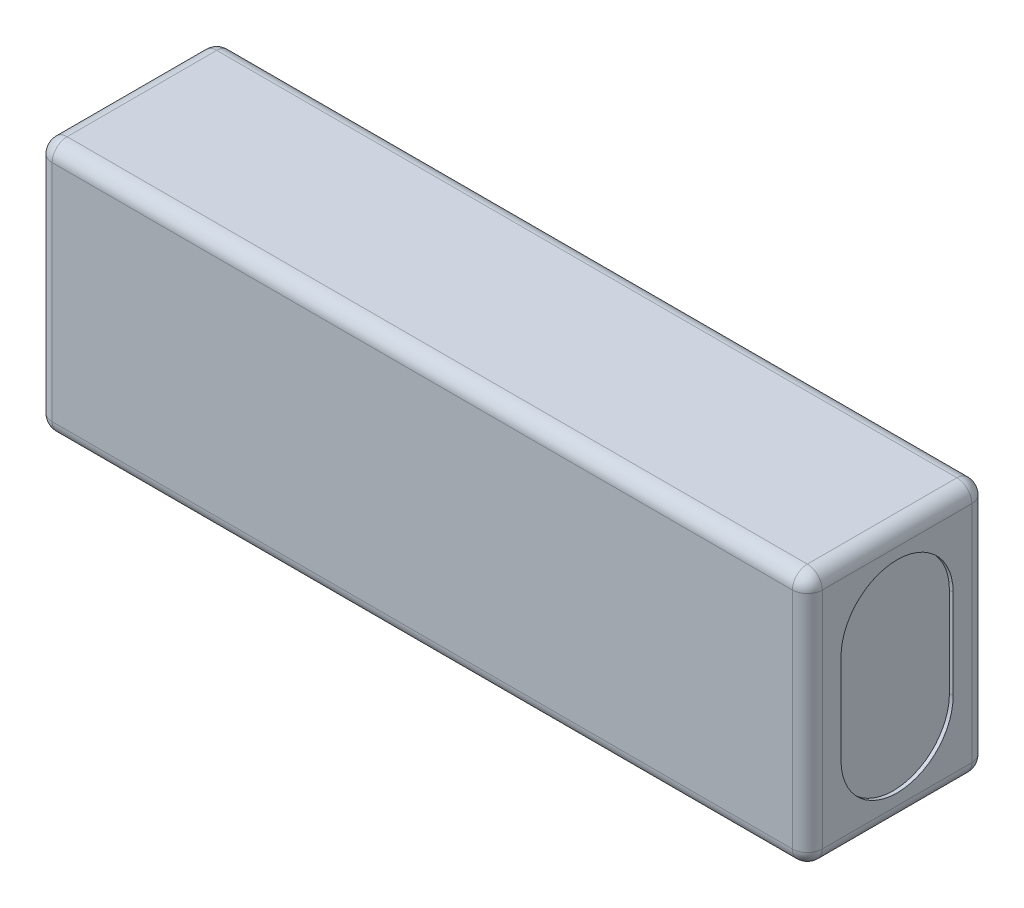
from build123d import *

# Parameters (mm, degrees)
ESBO_O1_W                = 103
ESBO_O1_H                = 34
RESSALTO_EXTRUS_O1_DEPTH = 24
CORTE_EXTRUS_O1_DEPTH    = 0.5
FILETE1_R                = 2
CORTAR_EXTRUIR1_DEPTH    = 3
CORTAR_EXTRUIR2_DEPTH    = 3


with BuildPart() as part:
    # Esboço1 → Ressalto-extrusão1 (new body)
    with BuildSketch(Plane.XY):
        Rectangle(ESBO_O1_W, ESBO_O1_H)
    extrude(amount=RESSALTO_EXTRUS_O1_DEPTH)

    # Esboço2 → Corte-extrusão1 (cut)
    with BuildSketch(Plane(origin=(51.5, 0, 0), x_dir=(0, 0, -1), z_dir=(1, 0, 0))):
        with BuildLine():
            Line((-4.5, 6), (-4.5, -6))
            ThreePointArc((-4.5, -6), (-12, -13.5), (-19.5, -6))
            Line((-19.5, -6), (-19.5, 6))
            ThreePointArc((-19.5, 6), (-12, 13.5), (-4.5, 6))
        make_face()
    corte_extrus_o1 = extrude(amount=-CORTE_EXTRUS_O1_DEPTH, mode=Mode.SUBTRACT)

    # Espelhar1: Corte-extrusão1 across plane
    add(corte_extrus_o1.mirror(Plane(origin=(0, 0, 0), x_dir=(0, 0, 1), z_dir=(1, 0, 0))), mode=Mode.SUBTRACT)

    # Filete1
    filete1_edges = [part.edges().sort_by_distance(p)[0] for p in [
        (-51.5, -17, 12),
        (51.5, -17, 12),
        (-51.5, 0, 0),
        (0, -17, 0),
        (51.5, 0, 0),
        (51.5, 17, 12),
        (-51.5, 17, 12),
        (0, 17, 0),
        (0, -17, 24),
        (-51.5, 0, 24),
        (0, 17, 24),
        (51.5, 0, 24),
    ]]
    fillet(filete1_edges, radius=FILETE1_R)

    # Croquis1 → Cortar-Extruir1 (cut)
    # profile 1 of 8: a face of its own
    with BuildSketch(Plane(origin=(0, 0, 0), x_dir=(-1, 0, 0), z_dir=(0, 0, -1))):
        with BuildLine():
            Line((14.710484833, -14.570833333), (13.843818166, -12.870833333))
            add(Edge.make_bspline(
                [(13.843818166, -12.870833333), (13.958170759, -12.703542924), (14.181699534, -12.376534855), (14.489392156, -11.88514262), (14.766020168, -11.40779189), (15.007829837, -10.942361336), (15.219569546, -10.490589854), (15.397052292, -10.051079459), (15.541781428, -9.624670825), (15.654916805, -9.211509181), (15.737706931, -8.811563324), (15.785349309, -8.423413003), (15.805115266, -8.048809228), (15.794117059, -7.686709348), (15.746500624, -7.338396338), (15.673281285, -7.002110316), (15.564414965, -6.679075611), (15.468690866, -6.474866277), (15.4209015, -6.372916667)],
                knots=[0, 0, 0, 0, 1.386874092, 2.710968426, 3.967339411, 5.162138991, 6.299838256, 7.381089098, 8.404710582, 9.380221754, 10.311477229, 11.197592997, 12.054241701, 12.877043452, 13.672977478, 14.457143812, 15.229743402, 16, 16, 16, 16], degree=3))
            add(Edge.make_bspline(
                [(15.4209015, -6.372916667), (15.36967133, -6.279392769), (15.272878992, -6.10269227), (15.09015999, -5.879263388), (14.886981402, -5.713495471), (14.70042847, -5.623047439), (14.545400471, -5.580483083), (14.424224103, -5.564146909), (14.298382816, -5.562230205), (14.168462982, -5.575080738), (14.033944909, -5.602960689), (13.894577206, -5.644833697), (13.74982171, -5.701655587), (13.653913795, -5.748600076), (13.604234833, -5.772916667)],
                knots=[0, 0, 0, 0, 1.744049898, 3.295141614, 4.69500516, 6.00762196, 6.656096225, 7.322091996, 8.004686246, 8.713230415, 9.456096588, 10.251451713, 11.094276379, 12, 12, 12, 12], degree=3))
            add(Edge.make_bspline(
                [(13.604234833, -5.772916667), (13.516728686, -5.822136873), (13.33770015, -5.922836331), (13.089209826, -6.119663891), (12.855549989, -6.357673796), (12.638284722, -6.629978033), (12.440860256, -6.927684318), (12.274711277, -7.244729034), (12.138251413, -7.575602177), (12.076766835, -7.805449625), (12.0459015, -7.920833333)],
                knots=[0, 0, 0, 0, 0.881565451, 1.80359183, 2.774889872, 3.808409662, 4.861594173, 5.910221458, 6.950928537, 8, 8, 8, 8], degree=3))
            Line((12.0459015, -7.920833333), (10.512568166, -7.291666667))
            add(Edge.make_bspline(
                [(10.512568166, -7.291666667), (10.523231385, -7.214386688), (10.544606336, -7.059475144), (10.597383723, -6.830406403), (10.667032815, -6.603749328), (10.751804414, -6.379274474), (10.854955395, -6.15763613), (10.973303595, -5.938754305), (11.110508726, -5.723361579), (11.311133259, -5.439252477), (11.592756838, -5.106977525), (11.967867262, -4.749118957), (12.379994832, -4.439661689), (12.679251544, -4.273074506), (12.829234833, -4.189583333)],
                knots=[0, 0, 0, 0, 0.698167838, 1.399512007, 2.101627369, 2.819854132, 3.545896084, 4.288701636, 5.04593795, 5.830846765, 7.401476771, 8.936295476, 10.464514029, 12, 12, 12, 12], degree=3))
            add(Edge.make_bspline(
                [(12.829234833, -4.189583333), (12.947992832, -4.131836616), (13.178338389, -4.019829848), (13.524664208, -3.881478417), (13.859119438, -3.777112944), (14.180455865, -3.701202697), (14.491415384, -3.665015981), (14.789374808, -3.654321456), (15.076287025, -3.679360316), (15.350294891, -3.738221189), (15.613314234, -3.827725264), (15.863298642, -3.952802204), (16.101965534, -4.109104152), (16.325421691, -4.301901442), (16.539045835, -4.524214808), (16.741393648, -4.778953736), (16.928705248, -5.068344493), (17.040432489, -5.276242179), (17.097984833, -5.383333333)],
                knots=[0, 0, 0, 0, 1.245844834, 2.416467296, 3.514949439, 4.549845591, 5.526835404, 6.464280229, 7.358950065, 8.236782397, 9.103017955, 9.973407669, 10.867621415, 11.788078159, 12.752059148, 13.773422843, 14.853057369, 16, 16, 16, 16], degree=3))
            add(Edge.make_bspline(
                [(17.097984833, -5.383333333), (17.149056274, -5.488819357), (17.250911124, -5.699196483), (17.372040199, -6.028310589), (17.474182384, -6.36368958), (17.54528182, -6.709145427), (17.59717222, -7.061704609), (17.61814504, -7.423987688), (17.618950471, -7.794152434), (17.593138268, -8.173401764), (17.542788216, -8.560850413), (17.467611408, -8.958207794), (17.364654429, -9.364037263), (17.236841093, -9.779610931), (17.084253217, -10.20491532), (16.906772832, -10.639878569), (16.705390198, -11.084801386), (16.552826687, -11.37914547), (16.475068166, -11.529166667)],
                knots=[0, 0, 0, 0, 0.874437642, 1.743943627, 2.614916611, 3.489354254, 4.374286715, 5.272976794, 6.195777061, 7.136190132, 8.10845869, 9.110995401, 10.15335626, 11.232407227, 12.355672626, 13.525366447, 14.73872958, 16, 16, 16, 16], degree=3))
            Line((16.475068166, -11.529166667), (17.341734833, -13.229166667))
            Line((17.341734833, -13.229166667), (14.710484833, -14.570833333))
        make_face()
    # profile 2 of 8: a face of its own
    with BuildSketch(Plane(origin=(0, 0, 0), x_dir=(-1, 0, 0), z_dir=(0, 0, -1))):
        Polygon((15.085484833, -14.379166667), (14.3396515, -12.916666667), (19.9521515, -10.05625), (20.697984833, -11.51875), align=None)
    # profile 3 of 8: a face of its own
    with BuildSketch(Plane(origin=(0, 0, 0), x_dir=(-1, 0, 0), z_dir=(0, 0, -1))):
        with BuildLine():
            Line((22.194939636, -10.757313136), (21.32827297, -9.057313136))
            add(Edge.make_bspline(
                [(21.32827297, -9.057313136), (21.442625562, -8.890022726), (21.666154337, -8.563014657), (21.973846959, -8.071622422), (22.250474971, -7.594271692), (22.49228464, -7.128841138), (22.704024349, -6.677069656), (22.881507095, -6.237559261), (23.026236231, -5.811150627), (23.139371608, -5.397988983), (23.222161734, -4.998043126), (23.269804113, -4.609892805), (23.289570069, -4.23528903), (23.278571862, -3.87318915), (23.230955427, -3.52487614), (23.157736089, -3.188590118), (23.048869768, -2.865555413), (22.953145669, -2.661346079), (22.905356303, -2.559396469)],
                knots=[0, 0, 0, 0, 1.386874092, 2.710968426, 3.967339411, 5.162138991, 6.299838256, 7.381089098, 8.404710582, 9.380221754, 10.311477229, 11.197592997, 12.054241701, 12.877043452, 13.672977478, 14.457143812, 15.229743402, 16, 16, 16, 16], degree=3))
            add(Edge.make_bspline(
                [(22.905356303, -2.559396469), (22.854126133, -2.465872571), (22.757333796, -2.289172072), (22.574614793, -2.06574319), (22.371436205, -1.899975273), (22.184883273, -1.809527241), (22.029855274, -1.766962885), (21.908678906, -1.750626711), (21.782837619, -1.748710008), (21.652917785, -1.761560541), (21.518399712, -1.789440491), (21.379032009, -1.831313499), (21.234276513, -1.888135389), (21.138368598, -1.935079878), (21.088689636, -1.959396469)],
                knots=[0, 0, 0, 0, 1.744049898, 3.295141614, 4.69500516, 6.00762196, 6.656096225, 7.322091996, 8.004686246, 8.713230415, 9.456096588, 10.251451713, 11.094276379, 12, 12, 12, 12], degree=3))
            add(Edge.make_bspline(
                [(21.088689636, -1.959396469), (21.001183489, -2.008616676), (20.822154953, -2.109316133), (20.573664629, -2.306143694), (20.340004792, -2.544153598), (20.122739525, -2.816457835), (19.925315059, -3.11416412), (19.75916608, -3.431208836), (19.622706217, -3.762081979), (19.561221639, -3.991929427), (19.530356303, -4.107313136)],
                knots=[0, 0, 0, 0, 0.881565451, 1.80359183, 2.774889872, 3.808409662, 4.861594173, 5.910221458, 6.950928537, 8, 8, 8, 8], degree=3))
            Line((19.530356303, -4.107313136), (17.99702297, -3.478146469))
            add(Edge.make_bspline(
                [(17.99702297, -3.478146469), (18.007686189, -3.40086649), (18.029061139, -3.245954946), (18.081838526, -3.016886205), (18.151487618, -2.79022913), (18.236259217, -2.565754276), (18.339410198, -2.344115932), (18.457758399, -2.125234107), (18.594963529, -1.909841381), (18.795588062, -1.62573228), (19.077211642, -1.293457327), (19.452322065, -0.93559876), (19.864449635, -0.626141491), (20.163706347, -0.459554308), (20.313689636, -0.376063136)],
                knots=[0, 0, 0, 0, 0.698167838, 1.399512007, 2.101627369, 2.819854132, 3.545896084, 4.288701636, 5.04593795, 5.830846765, 7.401476771, 8.936295476, 10.464514029, 12, 12, 12, 12], degree=3))
            add(Edge.make_bspline(
                [(20.313689636, -0.376063136), (20.432447636, -0.318316418), (20.662793192, -0.20630965), (21.009119011, -0.06795822), (21.343574241, 0.036407254), (21.664910668, 0.112317501), (21.975870188, 0.148504217), (22.273829611, 0.159198742), (22.560741828, 0.134159882), (22.834749694, 0.075299009), (23.097769037, -0.014205067), (23.347753445, -0.139282006), (23.586420337, -0.295583955), (23.809876494, -0.488381244), (24.023500639, -0.71069461), (24.225848451, -0.965433538), (24.413160051, -1.254824295), (24.524887292, -1.462721981), (24.582439636, -1.569813136)],
                knots=[0, 0, 0, 0, 1.245844834, 2.416467296, 3.514949439, 4.549845591, 5.526835404, 6.464280229, 7.358950065, 8.236782397, 9.103017955, 9.973407669, 10.867621415, 11.788078159, 12.752059148, 13.773422843, 14.853057369, 16, 16, 16, 16], degree=3))
            add(Edge.make_bspline(
                [(24.582439636, -1.569813136), (24.633511078, -1.675299159), (24.735365928, -1.885676286), (24.856495002, -2.214790391), (24.958637187, -2.550169382), (25.029736624, -2.895625229), (25.081627023, -3.248184411), (25.102599844, -3.61046749), (25.103405274, -3.980632236), (25.077593071, -4.359881566), (25.027243019, -4.747330215), (24.952066211, -5.144687596), (24.849109232, -5.550517065), (24.721295897, -5.966090733), (24.56870802, -6.391395122), (24.391227635, -6.826358371), (24.189845001, -7.271281188), (24.03728149, -7.565625272), (23.95952297, -7.715646469)],
                knots=[0, 0, 0, 0, 0.874437642, 1.743943627, 2.614916611, 3.489354254, 4.374286715, 5.272976794, 6.195777061, 7.136190132, 8.10845869, 9.110995401, 10.15335626, 11.232407227, 12.355672626, 13.525366447, 14.73872958, 16, 16, 16, 16], degree=3))
            Line((23.95952297, -7.715646469), (24.826189636, -9.415646469))
            Line((24.826189636, -9.415646469), (22.194939636, -10.757313136))
        make_face()
    # profile 4 of 8: a face of its own
    with BuildSketch(Plane(origin=(0, 0, 0), x_dir=(-1, 0, 0), z_dir=(0, 0, -1))):
        Polygon((22.569939636, -10.565646469), (21.824106303, -9.103146469), (27.436606303, -6.242729802), (28.182439636, -7.705229802), align=None)
    # profile 5 of 8: a face of its own
    with BuildSketch(Plane(origin=(0, 0, 0), x_dir=(-1, 0, 0), z_dir=(0, 0, -1))):
        with BuildLine():
            add(Edge.make_bspline(
                [(32.650227773, -5.585459604), (32.522182287, -5.646437791), (32.272911635, -5.765146172), (31.88943197, -5.894873778), (31.512163432, -5.977953544), (31.140432108, -6.012179123), (30.774733446, -5.997739162), (30.415956659, -5.934801961), (30.064444492, -5.822848862), (29.721057856, -5.661339936), (29.381223282, -5.457072355), (29.052568174, -5.199078115), (28.728088785, -4.898329388), (28.414031728, -4.546689411), (28.102907062, -4.151004407), (27.803063489, -3.704372705), (27.502251154, -3.215002383), (27.319586246, -2.864456395), (27.225227773, -2.683376271)],
                knots=[0, 0, 0, 0, 0.972791327, 1.893767099, 2.771648977, 3.618763643, 4.448809651, 5.276333633, 6.111468856, 6.973036975, 7.875509992, 8.827001737, 9.835445421, 10.908601539, 12.059507296, 13.28769905, 14.598917663, 16, 16, 16, 16], degree=3))
            add(Edge.make_bspline(
                [(27.225227773, -2.683376271), (27.132495267, -2.495313326), (26.952927518, -2.131147176), (26.720803531, -1.588552376), (26.531572893, -1.06934641), (26.387164018, -0.572326497), (26.282919877, -0.099268202), (26.223984267, 0.350338379), (26.204966039, 0.776601145), (26.231948298, 1.179683918), (26.299279235, 1.560006737), (26.413135751, 1.916479801), (26.570041744, 2.249153731), (26.769372596, 2.559068592), (27.015275252, 2.841428764), (27.299196813, 3.103853993), (27.630459396, 3.338460909), (27.873083673, 3.471147201), (27.998144439, 3.539540396)],
                knots=[0, 0, 0, 0, 1.414162829, 2.738392907, 3.978602539, 5.139342299, 6.227140167, 7.242742055, 8.194367426, 9.100461475, 9.962273064, 10.79332786, 11.616810396, 12.436661239, 13.270404687, 14.135659191, 15.039024894, 16, 16, 16, 16], degree=3))
            add(Edge.make_bspline(
                [(27.998144439, 3.539540396), (28.126117434, 3.600699233), (28.375642246, 3.7199482), (28.760944586, 3.847371673), (29.139976761, 3.925628972), (29.513076451, 3.955997513), (29.880107715, 3.937061771), (30.242006133, 3.870350326), (30.596400906, 3.751272419), (30.945118372, 3.585363715), (31.285628254, 3.367250329), (31.621722313, 3.104169132), (31.949809807, 2.79002197), (32.271581417, 2.429416683), (32.587747275, 2.019685535), (32.895706057, 1.561198998), (33.201958484, 1.055907737), (33.390390183, 0.696191336), (33.487727773, 0.510373729)],
                knots=[0, 0, 0, 0, 0.956127064, 1.864279462, 2.729776978, 3.56158907, 4.382525076, 5.202150003, 6.036228186, 6.897493104, 7.800811164, 8.75860103, 9.772634942, 10.860836906, 12.01626337, 13.261073482, 14.585161056, 16, 16, 16, 16], degree=3))
            add(Edge.make_bspline(
                [(33.487727773, 0.510373729), (33.57741052, 0.327058593), (33.75104664, -0.027860608), (33.979031127, -0.555225621), (34.157152074, -1.062918637), (34.299837391, -1.546125408), (34.396044892, -2.008119798), (34.452630455, -2.447003877), (34.463678933, -2.863796777), (34.433006344, -3.258479558), (34.361702611, -3.631373222), (34.243091682, -3.981039805), (34.084149208, -4.308371714), (33.882255466, -4.613576989), (33.635907374, -4.893978429), (33.347793745, -5.150895688), (33.018692423, -5.386968849), (32.775456793, -5.517999122), (32.650227773, -5.585459604)],
                knots=[0, 0, 0, 0, 1.400693542, 2.711903904, 3.940567666, 5.091592223, 6.16757129, 7.176184249, 8.125022128, 9.023976657, 9.888664274, 10.723718141, 11.550844188, 12.379740048, 13.227659204, 14.105243685, 15.024491278, 16, 16, 16, 16], degree=3))
        make_face()
        with BuildLine():
            add(Edge.make_bspline(
                [(31.846061106, -4.010459604), (31.902660366, -3.978740434), (32.013171246, -3.916808293), (32.15848424, -3.798296619), (32.280644257, -3.663001555), (32.382951815, -3.5119064), (32.457479504, -3.340626185), (32.508800022, -3.15320958), (32.541004367, -2.949852039), (32.544721694, -2.728964543), (32.530218733, -2.491327269), (32.49227069, -2.236140595), (32.427700724, -1.96546387), (32.344153574, -1.676726393), (32.237395418, -1.370903865), (32.107516398, -1.047944229), (31.955445264, -0.708024385), (31.840701833, -0.478781696), (31.781477773, -0.360459604)],
                knots=[0, 0, 0, 0, 0.767218389, 1.498005083, 2.208284085, 2.919894802, 3.648828351, 4.409051354, 5.216217397, 6.080042961, 7.019293827, 8.033428459, 9.130587443, 10.312149367, 11.591698471, 12.964539516, 14.433267227, 16, 16, 16, 16], degree=3))
            add(Edge.make_bspline(
                [(31.781477773, -0.360459604), (31.717797575, -0.237750042), (31.594360359, 0.000109249), (31.400691226, 0.336907422), (31.208444117, 0.644922626), (31.018218591, 0.923695467), (30.827965262, 1.172292803), (30.641068911, 1.393636202), (30.451374829, 1.582112827), (30.265695281, 1.744982578), (30.08037095, 1.878291327), (29.893229162, 1.978155543), (29.709056496, 2.054242344), (29.52379362, 2.095921103), (29.33968951, 2.108995547), (29.156495757, 2.092578799), (28.974815424, 2.043232968), (28.859312684, 1.991171968), (28.800227773, 1.964540396)],
                knots=[0, 0, 0, 0, 1.585956033, 3.074205245, 4.455845197, 5.750854572, 6.944395414, 8.046206728, 9.071534914, 10.009164694, 10.877919926, 11.683554627, 12.438088112, 13.157082314, 13.851876403, 14.547948359, 15.257209459, 16, 16, 16, 16], degree=3))
            add(Edge.make_bspline(
                [(28.800227773, 1.964540396), (28.742937011, 1.932111092), (28.631015862, 1.868758384), (28.483140174, 1.74801826), (28.35856741, 1.6089524), (28.257705868, 1.451476001), (28.182192974, 1.275333498), (28.130555348, 1.081692487), (28.10151954, 0.870386597), (28.098970958, 0.64124154), (28.118467936, 0.394571149), (28.161006076, 0.13007357), (28.226084776, -0.152591242), (28.317201768, -0.452453314), (28.42960764, -0.770917691), (28.566422476, -1.106773893), (28.724255311, -1.46178828), (28.844361851, -1.701216833), (28.906477773, -1.825042938)],
                knots=[0, 0, 0, 0, 0.751123528, 1.467367623, 2.169766518, 2.876276179, 3.594100614, 4.350527484, 5.159554302, 6.024539128, 6.963506395, 7.983581587, 9.082590251, 10.274981948, 11.562321421, 12.939923353, 14.417409417, 16, 16, 16, 16], degree=3))
            add(Edge.make_bspline(
                [(28.906477773, -1.825042938), (28.967384156, -1.942888861), (29.085284879, -2.171011413), (29.271021566, -2.494101908), (29.455887418, -2.788613588), (29.641841474, -3.053985091), (29.826230372, -3.292248588), (30.011728145, -3.500696371), (30.19488868, -3.681900359), (30.379281038, -3.832882004), (30.562507985, -3.957389623), (30.746938411, -4.052842409), (30.932185898, -4.117772498), (31.116357274, -4.157554004), (31.301561253, -4.16267956), (31.485178625, -4.141500036), (31.670299388, -4.094350338), (31.786438052, -4.038917575), (31.846061106, -4.010459604)],
                knots=[0, 0, 0, 0, 1.562991085, 3.0255906, 4.390032982, 5.659071259, 6.842567491, 7.938031974, 8.944917549, 9.875345724, 10.742328273, 11.55113031, 12.314617174, 13.049638815, 13.761990542, 14.486736787, 15.22312371, 16, 16, 16, 16], degree=3))
        make_face(mode=Mode.SUBTRACT)
    # profile 6 of 8: a face of its own
    with BuildSketch(Plane(origin=(0, 0, 0), x_dir=(-1, 0, 0), z_dir=(0, 0, -1))):
        with BuildLine():
            add(Edge.make_bspline(
                [(30.925227773, -2.237542938), (30.863743792, -2.264376443), (30.743680855, -2.316775612), (30.54686787, -2.339994995), (30.350330921, -2.309840152), (30.15523245, -2.23627884), (29.969856769, -2.114978105), (29.797671565, -1.954193248), (29.641488875, -1.752653317), (29.557055163, -1.597935758), (29.512727773, -1.516709604)],
                knots=[0, 0, 0, 0, 0.904256005, 1.765787319, 2.639081566, 3.573037294, 4.566396487, 5.617231985, 6.74905548, 8, 8, 8, 8], degree=3))
            add(Edge.make_bspline(
                [(29.512727773, -1.516709604), (29.473494121, -1.433647625), (29.398726681, -1.275356683), (29.328941823, -1.031518436), (29.297499572, -0.798127855), (29.309047916, -0.575862382), (29.361863095, -0.372812089), (29.455214779, -0.196537346), (29.58886067, -0.050057867), (29.702274974, 0.015973538), (29.760644439, 0.049957062)],
                knots=[0, 0, 0, 0, 1.241299417, 2.365540217, 3.416845778, 4.414498349, 5.358161044, 6.232616681, 7.090403813, 8, 8, 8, 8], degree=3))
            add(Edge.make_bspline(
                [(29.760644439, 0.049957062), (29.822848658, 0.076866363), (29.943746942, 0.129166486), (30.141484348, 0.151502092), (30.339782949, 0.126032696), (30.534677625, 0.047358416), (30.722294078, -0.072180704), (30.895817133, -0.2326252), (31.05274594, -0.432708577), (31.137159718, -0.586150894), (31.181477773, -0.666709604)],
                knots=[0, 0, 0, 0, 0.910830485, 1.770263274, 2.649466184, 3.584490648, 4.583338588, 5.638510391, 6.760194957, 8, 8, 8, 8], degree=3))
            add(Edge.make_bspline(
                [(31.181477773, -0.666709604), (31.220580637, -0.750491615), (31.295137456, -0.910237465), (31.366624554, -1.155740928), (31.391869719, -1.391267903), (31.378739963, -1.61300933), (31.326280727, -1.814975046), (31.231562789, -1.990132123), (31.097845268, -2.136974639), (30.983591012, -2.203540059), (30.925227773, -2.237542938)],
                knots=[0, 0, 0, 0, 1.246590623, 2.376854844, 3.432504237, 4.428079045, 5.360184761, 6.224069747, 7.092821158, 8, 8, 8, 8], degree=3))
        make_face()
    # profile 7 of 8: a face of its own
    with BuildSketch(Plane(origin=(0, 0, 0), x_dir=(-1, 0, 0), z_dir=(0, 0, -1))):
        with BuildLine():
            add(Edge.make_bspline(
                [(40.134682576, -1.771939407), (40.00663709, -1.832917593), (39.757366438, -1.951625974), (39.373886773, -2.081353581), (38.996618235, -2.164433347), (38.624886911, -2.198658925), (38.25918825, -2.184218964), (37.900411462, -2.121281763), (37.548899296, -2.009328664), (37.205512659, -1.847819738), (36.865678085, -1.643552157), (36.537022977, -1.385557917), (36.212543588, -1.08480919), (35.898486532, -0.733169213), (35.587361865, -0.33748421), (35.287518292, 0.109147493), (34.986705957, 0.598517815), (34.804041049, 0.949063803), (34.709682576, 1.130143927)],
                knots=[0, 0, 0, 0, 0.972791327, 1.893767099, 2.771648977, 3.618763643, 4.448809651, 5.276333633, 6.111468856, 6.973036975, 7.875509992, 8.827001737, 9.835445421, 10.908601539, 12.059507296, 13.28769905, 14.598917663, 16, 16, 16, 16], degree=3))
            add(Edge.make_bspline(
                [(34.709682576, 1.130143927), (34.61695007, 1.318206872), (34.437382321, 1.682373022), (34.205258334, 2.224967822), (34.016027696, 2.744173788), (33.871618821, 3.241193701), (33.767374681, 3.714251996), (33.70843907, 4.163858577), (33.689420842, 4.590121343), (33.716403101, 4.993204116), (33.783734038, 5.373526935), (33.897590554, 5.729999999), (34.054496547, 6.062673929), (34.253827399, 6.372588789), (34.499730055, 6.654948961), (34.783651616, 6.917374191), (35.114914199, 7.151981107), (35.357538476, 7.284667399), (35.482599243, 7.353060593)],
                knots=[0, 0, 0, 0, 1.414162829, 2.738392907, 3.978602539, 5.139342299, 6.227140167, 7.242742055, 8.194367426, 9.100461475, 9.962273064, 10.79332786, 11.616810396, 12.436661239, 13.270404687, 14.135659191, 15.039024894, 16, 16, 16, 16], degree=3))
            add(Edge.make_bspline(
                [(35.482599243, 7.353060593), (35.610572237, 7.414219431), (35.860097049, 7.533468398), (36.245399389, 7.660891871), (36.624431564, 7.73914917), (36.997531254, 7.769517711), (37.364562518, 7.750581968), (37.726460936, 7.683870524), (38.080855709, 7.564792617), (38.429573175, 7.398883913), (38.770083057, 7.180770527), (39.106177116, 6.91768933), (39.43426461, 6.603542168), (39.75603622, 6.242936881), (40.072202079, 5.833205733), (40.380160861, 5.374719196), (40.686413287, 4.869427935), (40.874844986, 4.509711534), (40.972182576, 4.323893927)],
                knots=[0, 0, 0, 0, 0.956127064, 1.864279462, 2.729776978, 3.56158907, 4.382525076, 5.202150003, 6.036228186, 6.897493104, 7.800811164, 8.75860103, 9.772634942, 10.860836906, 12.01626337, 13.261073482, 14.585161056, 16, 16, 16, 16], degree=3))
            add(Edge.make_bspline(
                [(40.972182576, 4.323893927), (41.061865323, 4.140578791), (41.235501443, 3.785659589), (41.46348593, 3.258294577), (41.641606877, 2.750601561), (41.784292194, 2.267394789), (41.880499696, 1.805400399), (41.937085259, 1.366516321), (41.948133736, 0.949723421), (41.917461147, 0.55504064), (41.846157414, 0.182146976), (41.727546486, -0.167519607), (41.568604011, -0.494851516), (41.366710269, -0.800056791), (41.120362177, -1.080458231), (40.832248548, -1.33737549), (40.503147226, -1.573448651), (40.259911597, -1.704478925), (40.134682576, -1.771939407)],
                knots=[0, 0, 0, 0, 1.400693542, 2.711903904, 3.940567666, 5.091592223, 6.16757129, 7.176184249, 8.125022128, 9.023976657, 9.888664274, 10.723718141, 11.550844188, 12.379740048, 13.227659204, 14.105243685, 15.024491278, 16, 16, 16, 16], degree=3))
        make_face()
        with BuildLine():
            add(Edge.make_bspline(
                [(39.330515909, -0.196939407), (39.387115169, -0.165220237), (39.497626049, -0.103288095), (39.642939043, 0.015223579), (39.76509906, 0.150518643), (39.867406618, 0.301613798), (39.941934308, 0.472894013), (39.993254825, 0.660310618), (40.025459171, 0.863668159), (40.029176497, 1.084555655), (40.014673536, 1.322192929), (39.976725493, 1.577379602), (39.912155528, 1.848056328), (39.828608378, 2.136793805), (39.721850222, 2.442616333), (39.591971201, 2.765575969), (39.439900068, 3.105495813), (39.325156636, 3.334738502), (39.265932576, 3.453060593)],
                knots=[0, 0, 0, 0, 0.767218389, 1.498005083, 2.208284085, 2.919894802, 3.648828351, 4.409051354, 5.216217397, 6.080042961, 7.019293827, 8.033428459, 9.130587443, 10.312149367, 11.591698471, 12.964539516, 14.433267227, 16, 16, 16, 16], degree=3))
            add(Edge.make_bspline(
                [(39.265932576, 3.453060593), (39.202252378, 3.575770155), (39.078815162, 3.813629447), (38.885146029, 4.15042762), (38.69289892, 4.458442824), (38.502673394, 4.737215664), (38.312420065, 4.985813), (38.125523714, 5.207156399), (37.935829633, 5.395633025), (37.750150084, 5.558502775), (37.564825753, 5.691811525), (37.377683966, 5.791675741), (37.193511299, 5.867762542), (37.008248423, 5.909441301), (36.824144313, 5.922515744), (36.640950561, 5.906098997), (36.459270228, 5.856753165), (36.343767487, 5.804692166), (36.284682576, 5.778060593)],
                knots=[0, 0, 0, 0, 1.585956033, 3.074205245, 4.455845197, 5.750854572, 6.944395414, 8.046206728, 9.071534914, 10.009164694, 10.877919926, 11.683554627, 12.438088112, 13.157082314, 13.851876403, 14.547948359, 15.257209459, 16, 16, 16, 16], degree=3))
            add(Edge.make_bspline(
                [(36.284682576, 5.778060593), (36.227391814, 5.74563129), (36.115470665, 5.682278582), (35.967594977, 5.561538458), (35.843022213, 5.422472598), (35.742160672, 5.264996199), (35.666647777, 5.088853695), (35.615010152, 4.895212685), (35.585974343, 4.683906794), (35.583425761, 4.454761738), (35.60292274, 4.208091346), (35.645460879, 3.943593767), (35.710539579, 3.660928956), (35.801656571, 3.361066884), (35.914062443, 3.042602506), (36.050877279, 2.706746304), (36.208710114, 2.351731918), (36.328816655, 2.112303365), (36.390932576, 1.98847726)],
                knots=[0, 0, 0, 0, 0.751123528, 1.467367623, 2.169766518, 2.876276179, 3.594100614, 4.350527484, 5.159554302, 6.024539128, 6.963506395, 7.983581587, 9.082590251, 10.274981948, 11.562321421, 12.939923353, 14.417409417, 16, 16, 16, 16], degree=3))
            add(Edge.make_bspline(
                [(36.390932576, 1.98847726), (36.451838959, 1.870631337), (36.569739682, 1.642508784), (36.755476369, 1.31941829), (36.940342221, 1.02490661), (37.126296277, 0.759535107), (37.310685175, 0.52127161), (37.496182948, 0.312823827), (37.679343483, 0.131619839), (37.863735841, -0.019361806), (38.046962788, -0.143869425), (38.231393214, -0.239322211), (38.416640701, -0.3042523), (38.600812077, -0.344033806), (38.786016056, -0.349159363), (38.969633428, -0.327979838), (39.154754191, -0.28083014), (39.270892855, -0.225397377), (39.330515909, -0.196939407)],
                knots=[0, 0, 0, 0, 1.562991085, 3.0255906, 4.390032982, 5.659071259, 6.842567491, 7.938031974, 8.944917549, 9.875345724, 10.742328273, 11.55113031, 12.314617174, 13.049638815, 13.761990542, 14.486736787, 15.22312371, 16, 16, 16, 16], degree=3))
        make_face(mode=Mode.SUBTRACT)
    # profile 8 of 8: a face of its own
    with BuildSketch(Plane(origin=(0, 0, 0), x_dir=(-1, 0, 0), z_dir=(0, 0, -1))):
        with BuildLine():
            add(Edge.make_bspline(
                [(38.409682576, 1.57597726), (38.348198596, 1.549143755), (38.228135658, 1.496744585), (38.031322674, 1.473525202), (37.834785724, 1.503680045), (37.639687253, 1.577241358), (37.454311572, 1.698542092), (37.282126368, 1.85932695), (37.125943678, 2.060866881), (37.041509967, 2.215584439), (36.997182576, 2.296810593)],
                knots=[0, 0, 0, 0, 0.904256005, 1.765787319, 2.639081566, 3.573037294, 4.566396487, 5.617231985, 6.74905548, 8, 8, 8, 8], degree=3))
            add(Edge.make_bspline(
                [(36.997182576, 2.296810593), (36.957948924, 2.379872573), (36.883181484, 2.538163515), (36.813396627, 2.782001761), (36.781954375, 3.015392342), (36.793502719, 3.237657816), (36.846317898, 3.440708109), (36.939669582, 3.616982852), (37.073315473, 3.76346233), (37.186729778, 3.829493736), (37.245099243, 3.86347726)],
                knots=[0, 0, 0, 0, 1.241299417, 2.365540217, 3.416845778, 4.414498349, 5.358161044, 6.232616681, 7.090403813, 8, 8, 8, 8], degree=3))
            add(Edge.make_bspline(
                [(37.245099243, 3.86347726), (37.307303461, 3.890386561), (37.428201745, 3.942686684), (37.625939151, 3.96502229), (37.824237752, 3.939552893), (38.019132428, 3.860878614), (38.206748881, 3.741339493), (38.380271936, 3.580894998), (38.537200744, 3.380811621), (38.621614521, 3.227369304), (38.665932576, 3.146810593)],
                knots=[0, 0, 0, 0, 0.910830485, 1.770263274, 2.649466184, 3.584490648, 4.583338588, 5.638510391, 6.760194957, 8, 8, 8, 8], degree=3))
            add(Edge.make_bspline(
                [(38.665932576, 3.146810593), (38.70503544, 3.063028582), (38.779592259, 2.903282732), (38.851079357, 2.65777927), (38.876324523, 2.422252295), (38.863194766, 2.200510868), (38.81073553, 1.998545151), (38.716017593, 1.823388075), (38.582300071, 1.676545558), (38.468045816, 1.609980139), (38.409682576, 1.57597726)],
                knots=[0, 0, 0, 0, 1.246590623, 2.376854844, 3.432504237, 4.428079045, 5.360184761, 6.224069747, 7.092821158, 8, 8, 8, 8], degree=3))
        make_face()
    extrude(amount=-CORTAR_EXTRUIR1_DEPTH, mode=Mode.SUBTRACT)

    # Croquis2 → Cortar-Extruir2 (cut)
    with BuildSketch(Plane(origin=(0, 0, 0), x_dir=(-1, 0, 0), z_dir=(0, 0, -1))):
        with BuildLine():
            Line((-42.051282051, 9.307559269), (-42.58974359, 8.797142602))
            add(Edge.make_bspline(
                [(-42.58974359, 8.797142602), (-42.687181366, 8.888804328), (-42.879733459, 9.069942054), (-43.193653944, 9.304964045), (-43.521181212, 9.506296245), (-43.860606206, 9.670108718), (-44.203523314, 9.800814239), (-44.545380866, 9.893870519), (-44.882672269, 9.953215594), (-45.107006706, 9.960312333), (-45.217548077, 9.963809269)],
                knots=[0, 0, 0, 0, 1.08915593, 2.152340314, 3.188132944, 4.216796309, 5.218260357, 6.173443236, 7.099959455, 8, 8, 8, 8], degree=3))
            add(Edge.make_bspline(
                [(-45.217548077, 9.963809269), (-45.285377477, 9.962982057), (-45.420860358, 9.961329779), (-45.622104246, 9.940241349), (-45.82123752, 9.909911621), (-46.01788427, 9.866027865), (-46.212426842, 9.810409746), (-46.404188627, 9.74083882), (-46.593527336, 9.659728331), (-46.778659498, 9.566003384), (-46.958140505, 9.463043691), (-47.127654177, 9.34894661), (-47.288280975, 9.22736903), (-47.437001825, 9.095267071), (-47.574672199, 8.95383734), (-47.704568942, 8.805710728), (-47.822123534, 8.646840291), (-47.928305864, 8.480149039), (-48.023029101, 8.30856466), (-48.106646408, 8.133738681), (-48.176840584, 7.956250972), (-48.232379495, 7.775878817), (-48.278200803, 7.594017637), (-48.310436017, 7.409408196), (-48.328609461, 7.221852825), (-48.331753021, 7.096258309), (-48.333333333, 7.033120167)],
                knots=[0, 0, 0, 0, 1.02818874, 2.053710826, 3.065248034, 4.081641283, 5.106893873, 6.131558223, 7.173050175, 8.228653731, 9.27666206, 10.308777013, 11.325269123, 12.329503258, 13.32196095, 14.316845687, 15.314881793, 16.315733098, 17.311955233, 18.285320748, 19.252783886, 20.203351036, 21.145449891, 22.095197417, 23.042428769, 24, 24, 24, 24], degree=3))
            add(Edge.make_bspline(
                [(-48.333333333, 7.033120167), (-48.331821897, 6.968578532), (-48.328803151, 6.839671505), (-48.309482512, 6.64728336), (-48.273626031, 6.457752555), (-48.225690613, 6.270456289), (-48.165728982, 6.085073793), (-48.09098365, 5.902408773), (-48.002452449, 5.722467991), (-47.899979345, 5.546872757), (-47.787606938, 5.37582671), (-47.661720776, 5.214707667), (-47.527999609, 5.061370112), (-47.381571809, 4.919218585), (-47.227132725, 4.784450792), (-47.060068173, 4.660779748), (-46.883663252, 4.545823302), (-46.697648828, 4.441030263), (-46.504043263, 4.347413192), (-46.305529757, 4.264165399), (-46.101474126, 4.195606725), (-45.892948746, 4.139730517), (-45.680202203, 4.093929922), (-45.462154598, 4.064464962), (-45.240409181, 4.0430833), (-45.090931917, 4.04151996), (-45.015625, 4.040732346)],
                knots=[0, 0, 0, 0, 0.93586088, 1.869166235, 2.799637598, 3.729985548, 4.670839027, 5.622275134, 6.589130586, 7.576015415, 8.568469353, 9.55398029, 10.53834874, 11.515998671, 12.510579167, 13.508179873, 14.527009472, 15.561807829, 16.601455013, 17.643573243, 18.680854198, 19.719860599, 20.772568776, 21.833555941, 22.908541556, 24, 24, 24, 24], degree=3))
            add(Edge.make_bspline(
                [(-45.015625, 4.040732346), (-44.924868306, 4.042629499), (-44.746652791, 4.046354866), (-44.484679906, 4.075355445), (-44.233073764, 4.120649032), (-43.992541358, 4.186980826), (-43.762803316, 4.271588176), (-43.543017434, 4.373578948), (-43.334914116, 4.496865067), (-43.137867769, 4.636012801), (-42.956353398, 4.791042466), (-42.79264515, 4.958331376), (-42.649354172, 5.137067509), (-42.524344773, 5.32619814), (-42.420927464, 5.52728875), (-42.336041874, 5.739353875), (-42.270975291, 5.962488899), (-42.244265341, 6.116672162), (-42.230769231, 6.1945785)],
                knots=[0, 0, 0, 0, 1.13008108, 2.219097802, 3.278683437, 4.311054135, 5.322181354, 6.324827112, 7.324222904, 8.330512327, 9.32562643, 10.293043162, 11.24128371, 12.174520618, 13.111833804, 14.052305215, 15.015860969, 16, 16, 16, 16], degree=3))
            Line((-42.230769231, 6.1945785), (-44.564102564, 6.1945785))
            Line((-44.564102564, 6.1945785), (-44.564102564, 6.912527218))
            Line((-44.564102564, 6.912527218), (-41.602564103, 6.912527218))
            add(Edge.make_bspline(
                [(-41.602564103, 6.912527218), (-41.605975799, 6.77871224), (-41.612653106, 6.516812157), (-41.659490937, 6.134871615), (-41.735123962, 5.774128228), (-41.838444586, 5.434202085), (-41.972195146, 5.1155749), (-42.134940203, 4.817923167), (-42.329284445, 4.543169806), (-42.548305328, 4.289071798), (-42.794105244, 4.062413374), (-43.060042484, 3.863201498), (-43.346556421, 3.695396267), (-43.653376036, 3.558874943), (-43.979496902, 3.452326953), (-44.325673662, 3.376783799), (-44.691436863, 3.331523873), (-44.942110217, 3.325741114), (-45.0703125, 3.322783628)],
                knots=[0, 0, 0, 0, 1.140356446, 2.231883559, 3.274166699, 4.278491846, 5.25512956, 6.21435461, 7.1637429, 8.11826594, 9.068280886, 10.0076534, 10.945064095, 11.891975133, 12.864533718, 13.863980011, 14.907571808, 16, 16, 16, 16], degree=3))
            add(Edge.make_bspline(
                [(-45.0703125, 3.322783628), (-45.149332771, 3.323921871), (-45.305186212, 3.326166852), (-45.535368069, 3.342121546), (-45.75920331, 3.366682699), (-45.976659328, 3.403772946), (-46.188536012, 3.449202254), (-46.393775182, 3.507375692), (-46.593158666, 3.57471309), (-46.786994637, 3.651304437), (-46.973523731, 3.740047751), (-47.153576765, 3.83866703), (-47.328149016, 3.946653751), (-47.496051346, 4.065875443), (-47.658158589, 4.195440363), (-47.813425476, 4.335608201), (-47.962721232, 4.48595044), (-48.056242159, 4.59270846), (-48.103365385, 4.646501577)],
                knots=[0, 0, 0, 0, 1.107784379, 2.184907829, 3.233506516, 4.263428166, 5.276301166, 6.270063455, 7.25232949, 8.225834625, 9.190232166, 10.146266622, 11.1027726, 12.066435141, 13.031522626, 14.010570082, 14.99756817, 16, 16, 16, 16], degree=3))
            add(Edge.make_bspline(
                [(-48.103365385, 4.646501577), (-48.171737248, 4.731842883), (-48.307346074, 4.901108917), (-48.481902387, 5.172308806), (-48.630705193, 5.453112526), (-48.751440837, 5.744301783), (-48.84571701, 6.045604209), (-48.913329515, 6.356634791), (-48.952944093, 6.677794052), (-48.958651168, 6.895124582), (-48.961538462, 7.005075295)],
                knots=[0, 0, 0, 0, 1.023165419, 2.029347347, 3.013907458, 3.994755782, 4.975994455, 5.96558838, 6.970761222, 8, 8, 8, 8], degree=3))
            add(Edge.make_bspline(
                [(-48.961538462, 7.005075295), (-48.960473985, 7.0874078), (-48.958358562, 7.251026415), (-48.932707529, 7.49394103), (-48.895904693, 7.732542414), (-48.841810584, 7.966635527), (-48.773618055, 8.19637671), (-48.688511083, 8.421872638), (-48.589421291, 8.643256381), (-48.474250298, 8.859004117), (-48.346081379, 9.066252943), (-48.206980939, 9.26416855), (-48.054973738, 9.44914668), (-47.892542139, 9.623529976), (-47.717748159, 9.78512767), (-47.532229311, 9.935435891), (-47.335842626, 10.074656263), (-47.127970266, 10.200595932), (-46.911714897, 10.313723173), (-46.687594894, 10.412901597), (-46.455678672, 10.494868228), (-46.217703717, 10.564415787), (-45.971868716, 10.615846068), (-45.719957642, 10.653143559), (-45.460657418, 10.678664758), (-45.285385359, 10.68071727), (-45.196514423, 10.681757987)],
                knots=[0, 0, 0, 0, 1.008945113, 2.00506715, 2.99143336, 3.967273523, 4.948097931, 5.927297278, 6.919902385, 7.919676788, 8.923139349, 9.905703106, 10.883022732, 11.856032218, 12.825136022, 13.798837087, 14.781400844, 15.773989409, 16.776158564, 17.77167057, 18.775803737, 19.789618931, 20.80898985, 21.851988756, 22.910860228, 24, 24, 24, 24], degree=3))
            add(Edge.make_bspline(
                [(-45.196514423, 10.681757987), (-45.124037936, 10.680599004), (-44.980325578, 10.678300875), (-44.766474114, 10.662371579), (-44.555928084, 10.637123817), (-44.348375305, 10.602670244), (-44.144522572, 10.555742863), (-43.943789161, 10.499586294), (-43.745884089, 10.434202648), (-43.55142759, 10.356224956), (-43.359112158, 10.267717706), (-43.167868477, 10.168090861), (-42.978349986, 10.055640852), (-42.790228023, 9.930033781), (-42.602316307, 9.793426945), (-42.417587022, 9.641913298), (-42.231581134, 9.481467786), (-42.111977505, 9.366103418), (-42.051282051, 9.307559269)],
                knots=[0, 0, 0, 0, 0.985871117, 1.954866573, 2.915460327, 3.869826059, 4.81536089, 5.759505086, 6.70452669, 7.649098992, 8.607881297, 9.583363685, 10.581137262, 11.603961102, 12.659522466, 13.73993555, 14.853081303, 16, 16, 16, 16], degree=3))
        make_face()
        Polygon((-40.166666667, 10.502270808), (-36.217948718, 10.502270808), (-36.217948718, 9.78432209), (-39.538461538, 9.78432209), (-39.538461538, 7.630475936), (-36.217948718, 7.630475936), (-36.217948718, 6.912527218), (-39.538461538, 6.912527218), (-39.538461538, 4.220219526), (-36.217948718, 4.220219526), (-36.217948718, 3.502270808), (-40.166666667, 3.502270808), align=None)
        Polygon((-34.961538462, 3.502270808), (-34.961538462, 10.502270808), (-34.829727564, 10.502270808), (-30.205128205, 4.992855743), (-30.205128205, 10.502270808), (-29.576923077, 10.502270808), (-29.576923077, 3.502270808), (-29.719951923, 3.502270808), (-34.333333333, 8.999065679), (-34.333333333, 3.502270808), align=None)
        with BuildLine():
            Line((-28.5, 4.852631384), (-27.908253205, 5.207399013))
            add(Edge.make_bspline(
                [(-27.908253205, 5.207399013), (-27.853216731, 5.115270243), (-27.747768969, 4.938755075), (-27.571866251, 4.700238994), (-27.389600429, 4.497514681), (-27.199621762, 4.331761466), (-27.003089865, 4.201263692), (-26.798721758, 4.108859229), (-26.587206136, 4.051227278), (-26.443258494, 4.044227105), (-26.371394231, 4.040732346)],
                knots=[0, 0, 0, 0, 1.272034388, 2.437168799, 3.508375237, 4.49857839, 5.41946034, 6.295179144, 7.148887113, 8, 8, 8, 8], degree=3))
            add(Edge.make_bspline(
                [(-26.371394231, 4.040732346), (-26.31002051, 4.042441691), (-26.188346964, 4.045830472), (-26.009222478, 4.078392076), (-25.835258873, 4.128416333), (-25.670041598, 4.200058197), (-25.515850369, 4.286735168), (-25.380636978, 4.391427523), (-25.263744752, 4.508639934), (-25.168126523, 4.639405244), (-25.094766452, 4.780039541), (-25.038382315, 4.924391444), (-25.007092168, 5.07472858), (-25.002378661, 5.175949506), (-25, 5.227030423)],
                knots=[0, 0, 0, 0, 1.095163259, 2.171163733, 3.241058638, 4.321873601, 5.38011039, 6.391990106, 7.366004449, 8.327778327, 9.272591725, 10.192022065, 11.087607919, 12, 12, 12, 12], degree=3))
            add(Edge.make_bspline(
                [(-25, 5.227030423), (-25.002948621, 5.285312122), (-25.008942738, 5.403790301), (-25.059605698, 5.578589607), (-25.139304192, 5.751574747), (-25.212829479, 5.858577278), (-25.251001603, 5.914129782)],
                knots=[0, 0, 0, 0, 0.938893495, 1.908633276, 2.914225137, 4, 4, 4, 4], degree=3))
            add(Edge.make_bspline(
                [(-25.251001603, 5.914129782), (-25.282342831, 5.954223429), (-25.34813982, 6.038395026), (-25.461254845, 6.163685497), (-25.593987073, 6.292922335), (-25.741794183, 6.431040449), (-25.910060361, 6.571616042), (-26.09351539, 6.721352598), (-26.296843108, 6.874555752), (-26.439442101, 6.977300883), (-26.513020833, 7.030315679)],
                knots=[0, 0, 0, 0, 0.722233717, 1.516239348, 2.393582979, 3.351407094, 4.387010283, 5.505090956, 6.712668013, 8, 8, 8, 8], degree=3))
            add(Edge.make_bspline(
                [(-26.513020833, 7.030315679), (-26.586668826, 7.082772855), (-26.727478179, 7.183066979), (-26.924395344, 7.331915547), (-27.10048427, 7.468003286), (-27.254962303, 7.59261131), (-27.387761496, 7.70575652), (-27.499928318, 7.806352398), (-27.588605433, 7.89711952), (-27.637916594, 7.956002203), (-27.66005609, 7.982439077)],
                knots=[0, 0, 0, 0, 1.452282411, 2.77665338, 3.964542531, 5.026858415, 5.96415736, 6.766646006, 7.446254459, 8, 8, 8, 8], degree=3))
            add(Edge.make_bspline(
                [(-27.66005609, 7.982439077), (-27.69100118, 8.02364115), (-27.751858854, 8.104670558), (-27.832190865, 8.231320274), (-27.90046919, 8.360966804), (-27.953993854, 8.493958534), (-27.999066292, 8.628428391), (-28.029382154, 8.766130883), (-28.048364947, 8.90644812), (-28.05030892, 9.000875121), (-28.051282051, 9.048144205)],
                knots=[0, 0, 0, 0, 1.068054152, 2.10047183, 3.106115577, 4.101338837, 5.06977816, 6.043150881, 7.020423561, 8, 8, 8, 8], degree=3))
            add(Edge.make_bspline(
                [(-28.051282051, 9.048144205), (-28.048671633, 9.122203754), (-28.043506593, 9.268739882), (-27.999825559, 9.482801542), (-27.930879771, 9.687174377), (-27.834289996, 9.879835044), (-27.70977529, 10.055767006), (-27.565683341, 10.21699398), (-27.394060369, 10.352531145), (-27.205755122, 10.470955261), (-26.999642378, 10.563647112), (-26.783660571, 10.633569072), (-26.557466427, 10.673187587), (-26.404260158, 10.678873117), (-26.326522436, 10.681757987)],
                knots=[0, 0, 0, 0, 1.005424448, 1.989358655, 2.955360095, 3.929531133, 4.905563448, 5.876582895, 6.856512386, 7.866279853, 8.892233794, 9.918561126, 10.94386622, 12, 12, 12, 12], degree=3))
            add(Edge.make_bspline(
                [(-26.326522436, 10.681757987), (-26.244034235, 10.678912884), (-26.079991532, 10.673254882), (-25.838693101, 10.624059819), (-25.606371668, 10.542658475), (-25.419485138, 10.450281159), (-25.273219615, 10.358018328), (-25.16167415, 10.273978679), (-25.048639248, 10.177228462), (-24.933203139, 10.06750997), (-24.81732182, 9.943816468), (-24.699274915, 9.80699509), (-24.578786378, 9.657881978), (-24.501274657, 9.551432977), (-24.461538462, 9.496862154)],
                knots=[0, 0, 0, 0, 1.286793592, 2.559021753, 3.825965368, 5.121522368, 5.803751409, 6.523245864, 7.299691795, 8.125521123, 9.008227632, 9.944561021, 10.946284179, 12, 12, 12, 12], degree=3))
            Line((-24.461538462, 9.496862154), (-25.029447115, 9.066373372))
            add(Edge.make_bspline(
                [(-25.029447115, 9.066373372), (-25.06373898, 9.110550753), (-25.129777094, 9.195626059), (-25.230036068, 9.31476869), (-25.324533364, 9.423601649), (-25.417634164, 9.518131905), (-25.504421427, 9.603536172), (-25.588655511, 9.676655686), (-25.669124214, 9.738206876), (-25.770558035, 9.803893996), (-25.897993471, 9.869007004), (-26.057962544, 9.92410516), (-26.225135094, 9.957215283), (-26.338994357, 9.961593059), (-26.396634615, 9.963809269)],
                knots=[0, 0, 0, 0, 1.181633172, 2.275549214, 3.290209073, 4.226197932, 5.078386478, 5.862611352, 6.581680152, 7.217281963, 8.414376989, 9.595101626, 10.782541182, 12, 12, 12, 12], degree=3))
            add(Edge.make_bspline(
                [(-26.396634615, 9.963809269), (-26.46894766, 9.961385869), (-26.608396555, 9.956712571), (-26.806377027, 9.9056726), (-26.984564877, 9.82530888), (-27.137670007, 9.712678923), (-27.265143962, 9.579236938), (-27.357354879, 9.425679228), (-27.412855208, 9.256114423), (-27.419627768, 9.13783111), (-27.423076923, 9.07759132)],
                knots=[0, 0, 0, 0, 1.14458467, 2.207223713, 3.21896685, 4.227309161, 5.202851033, 6.127160689, 7.046193047, 8, 8, 8, 8], degree=3))
            add(Edge.make_bspline(
                [(-27.423076923, 9.07759132), (-27.42229067, 9.040088363), (-27.420716878, 8.965021124), (-27.398767282, 8.854118281), (-27.370568624, 8.743495602), (-27.325883361, 8.633650436), (-27.264192754, 8.522661718), (-27.183182402, 8.408618243), (-27.081155778, 8.290514825), (-27.003001753, 8.213700078), (-26.961738782, 8.173144205)],
                knots=[0, 0, 0, 0, 0.858281714, 1.717966888, 2.583508476, 3.4729293, 4.427298488, 5.488583878, 6.674047936, 8, 8, 8, 8], degree=3))
            add(Edge.make_bspline(
                [(-26.961738782, 8.173144205), (-26.946416037, 8.159470153), (-26.910012703, 8.126983737), (-26.843460851, 8.073799175), (-26.755575255, 8.008193631), (-26.648650853, 7.927018998), (-26.520716129, 7.832856074), (-26.371757017, 7.726908849), (-26.203433951, 7.605737931), (-26.083990119, 7.52102285), (-26.020833333, 7.476229141)],
                knots=[0, 0, 0, 0, 0.420754252, 0.999615792, 1.744751191, 2.668019286, 3.750313428, 4.999500688, 6.413464383, 8, 8, 8, 8], degree=3))
            add(Edge.make_bspline(
                [(-26.020833333, 7.476229141), (-25.944861507, 7.420946422), (-25.797752594, 7.313899098), (-25.588437434, 7.153067738), (-25.398649818, 6.995772201), (-25.227723411, 6.843016987), (-25.073969594, 6.695960801), (-24.939094153, 6.55283444), (-24.821722792, 6.414663295), (-24.695364355, 6.237518143), (-24.566248716, 6.019955975), (-24.455365701, 5.753399498), (-24.385449006, 5.485806857), (-24.376305975, 5.305953184), (-24.371794872, 5.217214718)],
                knots=[0, 0, 0, 0, 1.163667725, 2.253281268, 3.268753668, 4.215851969, 5.092017293, 5.902905408, 6.650798638, 7.335211899, 8.59617414, 9.77448103, 10.901945474, 12, 12, 12, 12], degree=3))
            add(Edge.make_bspline(
                [(-24.371794872, 5.217214718), (-24.373109148, 5.154457988), (-24.375712178, 5.030163221), (-24.405634006, 4.847653067), (-24.449473336, 4.670391327), (-24.515547804, 4.500569103), (-24.59619412, 4.335079577), (-24.698526616, 4.178263776), (-24.817141986, 4.026650979), (-24.953209516, 3.884283996), (-25.10210132, 3.753591604), (-25.259468709, 3.637333482), (-25.425569255, 3.540396835), (-25.599501889, 3.461295151), (-25.781306562, 3.399428116), (-25.97092213, 3.354602377), (-26.168661152, 3.327090955), (-26.303062115, 3.324235433), (-26.371394231, 3.322783628)],
                knots=[0, 0, 0, 0, 0.983748083, 1.948392443, 2.894712957, 3.844097841, 4.80183111, 5.778335162, 6.776009319, 7.81870978, 8.863265674, 9.881300176, 10.883814829, 11.87499822, 12.874611388, 13.892143829, 14.928324115, 16, 16, 16, 16], degree=3))
            add(Edge.make_bspline(
                [(-26.371394231, 3.322783628), (-26.424264917, 3.323805991), (-26.529340437, 3.325837842), (-26.684759401, 3.343800403), (-26.837038579, 3.36921461), (-26.984267143, 3.40956275), (-27.128341966, 3.458516704), (-27.268636435, 3.518793369), (-27.405218543, 3.591027772), (-27.538853709, 3.673617821), (-27.669202058, 3.769733311), (-27.795040994, 3.881680303), (-27.920499365, 4.006371313), (-28.041874158, 4.14719244), (-28.161620446, 4.301868606), (-28.277377265, 4.471846973), (-28.391540701, 4.65620168), (-28.463171636, 4.785931852), (-28.5, 4.852631384)],
                knots=[0, 0, 0, 0, 0.915332311, 1.819136955, 2.706846663, 3.586547465, 4.459518054, 5.340707479, 6.227863349, 7.133153174, 8.059268498, 9.028702269, 10.047606654, 11.120612155, 12.245963614, 13.433783089, 14.680604001, 16, 16, 16, 16], degree=3))
        make_face()
        Polygon((-24.148665753, 2.726446979), (-23.40908242, 2.726446979), (-23.40908242, -1.273553021), (-23.768056779, -1.273553021), (-23.768056779, 2.316190569), (-24.383441394, 2.316190569), align=None)
        Polygon((-21.071742676, 2.726446979), (-20.332159343, 2.726446979), (-20.332159343, -1.273553021), (-20.691133702, -1.273553021), (-20.691133702, 2.316190569), (-21.306518317, 2.316190569), align=None)
        with BuildLine():
            add(Edge.make_bspline(
                [(-18.203954215, -0.658168406), (-18.181679686, -0.659492025), (-18.138013078, -0.662086825), (-18.074882646, -0.679888738), (-18.017745892, -0.711498636), (-17.966851898, -0.753627525), (-17.924901639, -0.804708283), (-17.892165236, -0.861389322), (-17.874518396, -0.925048285), (-17.871942497, -0.968967913), (-17.870620881, -0.991501739)],
                knots=[0, 0, 0, 0, 1.020151414, 1.999887582, 2.974338812, 3.990962822, 5.007586832, 5.987933904, 6.967670073, 8, 8, 8, 8], degree=3))
            add(Edge.make_bspline(
                [(-17.870620881, -0.991501739), (-17.871987282, -1.013494116), (-17.874681805, -1.05686276), (-17.892124785, -1.120041574), (-17.925151128, -1.176758037), (-17.966562549, -1.228531909), (-18.017758473, -1.270750047), (-18.075017726, -1.302091012), (-18.137864878, -1.321167561), (-18.181654962, -1.323597614), (-18.203954215, -1.324835072)],
                knots=[0, 0, 0, 0, 1.009421747, 1.99056486, 2.972319754, 3.999869655, 5.017953583, 5.993804169, 6.978383603, 8, 8, 8, 8], degree=3))
            add(Edge.make_bspline(
                [(-18.203954215, -1.324835072), (-18.226269535, -1.32364239), (-18.269834887, -1.321313961), (-18.332447452, -1.301699325), (-18.390055416, -1.271043942), (-18.441241372, -1.228453189), (-18.482999625, -1.177024453), (-18.514571492, -1.119650972), (-18.533531662, -1.057043615), (-18.536025231, -1.013529737), (-18.537287548, -0.991501739)],
                knots=[0, 0, 0, 0, 1.022052826, 1.995314843, 2.982371812, 4.00089066, 5.028879526, 6.005146991, 6.990147033, 8, 8, 8, 8], degree=3))
            add(Edge.make_bspline(
                [(-18.537287548, -0.991501739), (-18.53607372, -0.968931019), (-18.533703871, -0.924864459), (-18.514531687, -0.861779765), (-18.483244588, -0.804444406), (-18.440952708, -0.753705457), (-18.390067799, -0.711205683), (-18.332586421, -0.680274491), (-18.269684089, -0.661942591), (-18.22624416, -0.659448286), (-18.203954215, -0.658168406)],
                knots=[0, 0, 0, 0, 1.032775665, 2.016367738, 2.991239715, 4.008302682, 5.025365648, 6.011011707, 6.979408107, 8, 8, 8, 8], degree=3))
        make_face()
        Polygon((-16.507640112, 2.726446979), (-15.768056779, 2.726446979), (-15.768056779, -1.273553021), (-16.127031138, -1.273553021), (-16.127031138, 2.316190569), (-16.742415753, 2.316190569), align=None)
        Polygon((-14.22959524, 2.726446979), (-13.844979856, 2.726446979), (-12.512447804, -0.423392765), (-11.179114471, 2.726446979), (-10.793697804, 2.726446979), (-12.486005497, -1.273553021), (-12.537287548, -1.273553021), align=None)
    extrude(amount=-CORTAR_EXTRUIR2_DEPTH, mode=Mode.SUBTRACT)


solid = part.part
